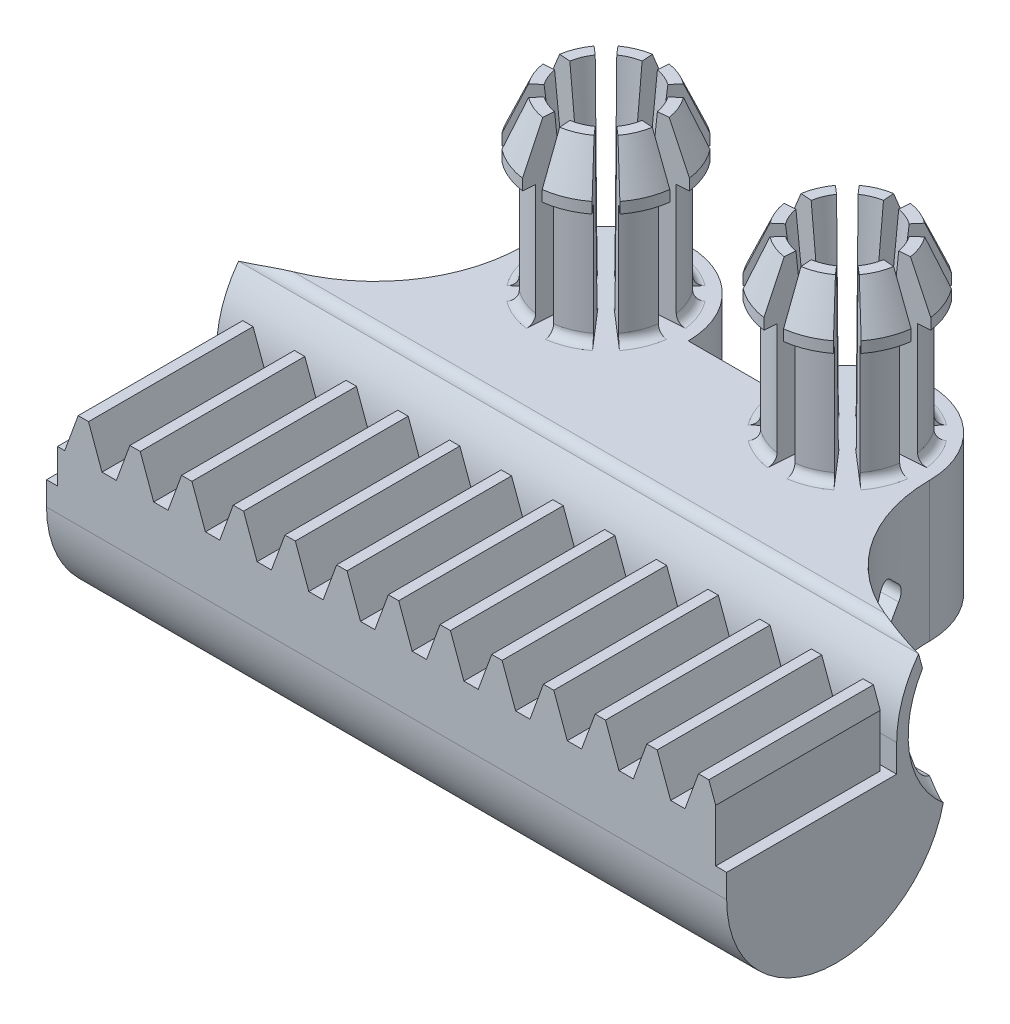
from build123d import *

# Parameters (mm, degrees)
BLANKSKE_W                 = 60
BLANKSKE_H                 = 6.5
BLANK_DEPTH                = 10
TOOTHCUTSIM_DEPTH          = 62.173932357
TEETHCUTS_COUNT            = 14
TEETHCUTS_PITCH            = 4.712388975
BOSS_EXTRUDE1_DEPTH        = 1
BOSS_EXTRUDE1_DEPTH_BACK   = 61
BOSS_EXTRUDE2_DEPTH        = 2.71
BOSS_EXTRUDE2_DEPTH_BACK   = 10
SKETCH2_R                  = 7.5
BOSS_EXTRUDE2_2_DEPTH      = 2.71
BOSS_EXTRUDE2_2_DEPTH_BACK = 10
BOSS_EXTRUDE3_REACH        = 74.801
CUT_EXTRUDE1_REACH         = 74.801
CIRPATTERN1_COUNT          = 8
FILLET1_R                  = 0.8
MIRROR2_COPY_1_REACH       = 74.801
MIRROR2_COPY_2_REACH       = 74.801
MIRROR2_COPY_3_REACH       = 74.801
MIRROR2_COPY_4_REACH       = 74.801
MIRROR2_COPY_5_REACH       = 74.801
MIRROR2_COPY_6_REACH       = 74.801
MIRROR2_COPY_7_REACH       = 74.801
FILLET1_OF_MIRROR2_R       = 0.8
CUT_EXTRUDE2_REACH         = 76.845
FILLET2_R                  = 8
BOSS_EXTRUDE4_DEPTH        = 5
CUT_EXTRUDE3_REACH         = 76.845
FILLET3_R                  = 10
FILLET4_R                  = 1


with BuildPart() as part:
    # BlankSke → Blank (new body)
    with BuildSketch(Plane.XY):
        with Locations((30, 3.25)):
            Rectangle(BLANKSKE_W, BLANKSKE_H)
    extrude(amount=-BLANK_DEPTH)

    # TooCutSkeSim → ToothCutSim (cut, through all)
    with BuildSketch(Plane.XY):
        Polygon((0.654653055, 3.125), (-0.654653055, 3.125), (-1.892297439, 6.5254), (1.892297439, 6.5254), align=None)
    toothcutsim = extrude(amount=-TOOTHCUTSIM_DEPTH, mode=Mode.SUBTRACT)

    # TeethCuts: ToothCutSim ×14
    with Locations(*[(i * TEETHCUTS_PITCH, 0, 0) for i in range(1, TEETHCUTS_COUNT)]):
        add(toothcutsim, mode=Mode.SUBTRACT)

    # Sketch1 → Boss-Extrude1 (add, two sides: drawn at the far end of the back side and taken through both)
    with BuildSketch(Plane(origin=(60, 0, 0), x_dir=(0, 0, -1), z_dir=(1, 0, 0)).offset(-BOSS_EXTRUDE1_DEPTH_BACK)):
        with BuildLine():
            Line((0, 0), (0, -10.820508076))
            ThreePointArc((0, -10.820508076), (11.085943312, -10.095069348), (14.660347579, 0.423867603))
            Line((14.660347579, 0.423867603), (12.5, 8.5))
            Line((12.5, 8.5), (10.5, 8.5))
            Line((10.5, 8.5), (10.5, 0))
            Line((10.5, 0), (0, 0))
        make_face()
    extrude(amount=BOSS_EXTRUDE1_DEPTH + BOSS_EXTRUDE1_DEPTH_BACK)


with BuildPart() as body_2:
    # Sketch2 → Boss-Extrude2 (new, two sides: drawn at the far end of the back side and taken through both)
    with BuildSketch(Plane(origin=(0, 6.5, 0), x_dir=(1, 0, 0), z_dir=(0, 1, 0)).offset(-BOSS_EXTRUDE2_DEPTH_BACK)):
        with Locations(Location((19, 26, 0), (0, 0, 270))):
            Circle(SKETCH2_R)
    extrude(amount=BOSS_EXTRUDE2_DEPTH + BOSS_EXTRUDE2_DEPTH_BACK)


with BuildPart() as body_3:
    # Sketch2 → Boss-Extrude2 2 (new, two sides: drawn at the far end of the back side and taken through both)
    with BuildSketch(Plane(origin=(0, 6.5, 0), x_dir=(1, 0, 0), z_dir=(0, 1, 0)).offset(-BOSS_EXTRUDE2_2_DEPTH_BACK)):
        with Locations(Location((41, 26, 0), (0, 0, 90))):
            Circle(SKETCH2_R)
    extrude(amount=BOSS_EXTRUDE2_2_DEPTH + BOSS_EXTRUDE2_2_DEPTH_BACK)

    # Boss-Extrude3: up to this face of the body (flat: up to its plane)
    boss_extrude3_end = Plane(body_3.part.faces().sort_by_distance((41, -3.5, -26))[0])
    # Sketch3 → Boss-Extrude3 (add, up to the picked face)
    with BuildSketch(Plane(origin=(0, 9.21, 0), x_dir=(1, 0, 0), z_dir=(0, 1, 0)), mode=Mode.PRIVATE) as boss_extrude3_sk1:
        with BuildLine():
            Line((33.5, 26), (26.5, 26))
            ThreePointArc((26.5, 26), (19, 18.5), (11.5, 26))
            ThreePointArc((11.5, 26), (7.895119526, 16.800815254), (-1, 12.5))
            Line((-1, 12.5), (61, 12.5))
            ThreePointArc((61, 12.5), (52.104880474, 16.800815254), (48.5, 26))
            ThreePointArc((48.5, 26), (41, 18.5), (33.5, 26))
        make_face()
    boss_extrude3_tool1 = split(extrude(boss_extrude3_sk1.sketch, amount=-BOSS_EXTRUDE3_REACH, mode=Mode.PRIVATE), bisect_by=boss_extrude3_end, keep=Keep.BOTH, mode=Mode.PRIVATE)

    add(part.part)  # Boss-Extrude3 merges part

    add(body_2.part)  # Boss-Extrude3 merges body 2
    add(boss_extrude3_tool1.solids().sort_by(Axis((30, 9.21, -16.953382), (0, -1, 0)))[0])

    # Sketch4 → Revolve1 (revolve)
    with BuildSketch(Plane.ZY.offset(-19)):
        Polygon((-31.65, 9.21), (-31.65, 20.21), (-32.77, 20.21), (-32.77, 21.21), (-31.05, 25.21), (-30.05, 25.21), (-28.45, 9.21), align=None)
    revolve1 = revolve(axis=Axis((19, 9.21, -26), (0, 1, 0)))

    # Sketch5 → Cut-Extrude1 (cut, up to next)
    with BuildSketch(Plane(origin=(0, 9.21, 0), x_dir=(1, 0, 0), z_dir=(0, 1, 0)), mode=Mode.PRIVATE) as cut_extrude1_sk1:
        Polygon((19, 26.4), (25.77, 26.9), (25.77, 25.1), (19, 25.6), align=None)
    cut_extrude1_tool1 = extrude(cut_extrude1_sk1.sketch, amount=CUT_EXTRUDE1_REACH, mode=Mode.PRIVATE) & body_3.part
    cut_extrude1 = cut_extrude1_tool1.solids().sort_by_distance((22.818974, 9.21, -26))[0]
    add(cut_extrude1, mode=Mode.SUBTRACT)

    # CirPattern1: Cut-Extrude1 ×8 about axis
    cirpattern1_axis = Axis((19, 0, -26), (0, 1, 0))
    for i in range(1, CIRPATTERN1_COUNT):
        add(cut_extrude1.rotate(cirpattern1_axis, i * 360 / CIRPATTERN1_COUNT), mode=Mode.SUBTRACT)

    # Fillet1
    fillet1_edges = [body_3.edges().sort_by_distance(p)[0] for p in [
        (18.062425591, 9.21, -28.263504855),
        (16.736495145, 9.21, -26.937574409),
        (16.736495145, 9.21, -25.062425591),
        (18.062425591, 9.21, -23.736495145),
        (19.937574409, 9.21, -23.736495145),
        (21.263504855, 9.21, -25.062425591),
        (21.263504855, 9.21, -26.937574409),
        (19.937574409, 9.21, -28.263504855),
        (13.780080641, 9.21, -28.162161393),
        (16.837838607, 9.21, -31.219919359),
        (21.162161393, 9.21, -31.219919359),
        (24.219919359, 9.21, -28.162161393),
        (24.219919359, 9.21, -23.837838607),
        (21.162161393, 9.21, -20.780080641),
        (13.780080641, 9.21, -23.837838607),
        (16.837838607, 9.21, -20.780080641),
    ]]
    fillet(fillet1_edges, radius=FILLET1_R)

    # Mirror2: Revolve1, Cut-Extrude1 across plane
    add(revolve1.mirror(Plane.ZY.offset(-30)))
    add(cut_extrude1.mirror(Plane.ZY.offset(-30)), mode=Mode.SUBTRACT)

    # Mirror2 copy 1 sketch → Mirror2 copy 1 (cut, up to next)
    with BuildSketch(Plane(origin=(36.050252532, 9.21, 5.819805153), x_dir=(-0.7071067811865476, 0, -0.7071067811865475), z_dir=(0, 1, 0)), mode=Mode.PRIVATE) as mirror2_copy_1_sk1:
        Polygon((19, -26.4), (25.77, -26.9), (25.77, -25.1), (19, -25.6), align=None)
    mirror2_copy_1_tool1 = extrude(mirror2_copy_1_sk1.sketch, amount=MIRROR2_COPY_1_REACH, mode=Mode.PRIVATE) & body_3.part
    add(mirror2_copy_1_tool1.solids().sort_by_distance((38.299577587, 9.21, -28.700422413))[0], mode=Mode.SUBTRACT)

    # Mirror2 copy 2 sketch → Mirror2 copy 2 (cut, up to next)
    with BuildSketch(Plane(origin=(15, 9.21, -7), x_dir=(0, 0, -1), z_dir=(0, 1, 0)), mode=Mode.PRIVATE) as mirror2_copy_2_sk1:
        Polygon((19, -26.4), (25.77, -26.9), (25.77, -25.1), (19, -25.6), align=None)
    mirror2_copy_2_tool1 = extrude(mirror2_copy_2_sk1.sketch, amount=MIRROR2_COPY_2_REACH, mode=Mode.PRIVATE) & body_3.part
    add(mirror2_copy_2_tool1.solids().sort_by_distance((41, 9.21, -29.818974))[0], mode=Mode.SUBTRACT)

    # Mirror2 copy 3 sketch → Mirror2 copy 3 (cut, up to next)
    with BuildSketch(Plane(origin=(9.180194847, 9.21, -30.949747468), x_dir=(0.7071067811865475, 0, -0.7071067811865476), z_dir=(0, 1, 0)), mode=Mode.PRIVATE) as mirror2_copy_3_sk1:
        Polygon((19, -26.4), (25.77, -26.9), (25.77, -25.1), (19, -25.6), align=None)
    mirror2_copy_3_tool1 = extrude(mirror2_copy_3_sk1.sketch, amount=MIRROR2_COPY_3_REACH, mode=Mode.PRIVATE) & body_3.part
    add(mirror2_copy_3_tool1.solids().sort_by_distance((43.700422413, 9.21, -28.700422413))[0], mode=Mode.SUBTRACT)

    # Mirror2 copy 4 sketch → Mirror2 copy 4 (cut, up to next)
    with BuildSketch(Plane(origin=(22, 9.21, -52), x_dir=(1, 0, 0), z_dir=(0, 1, 0)), mode=Mode.PRIVATE) as mirror2_copy_4_sk1:
        Polygon((19, -26.4), (25.77, -26.9), (25.77, -25.1), (19, -25.6), align=None)
    mirror2_copy_4_tool1 = extrude(mirror2_copy_4_sk1.sketch, amount=MIRROR2_COPY_4_REACH, mode=Mode.PRIVATE) & body_3.part
    add(mirror2_copy_4_tool1.solids().sort_by_distance((44.818974, 9.21, -26))[0], mode=Mode.SUBTRACT)

    # Mirror2 copy 5 sketch → Mirror2 copy 5 (cut, up to next)
    with BuildSketch(Plane(origin=(45.949747468, 9.21, -57.819805153), x_dir=(0.7071067811865477, 0, 0.7071067811865475), z_dir=(0, 1, 0)), mode=Mode.PRIVATE) as mirror2_copy_5_sk1:
        Polygon((19, -26.4), (25.77, -26.9), (25.77, -25.1), (19, -25.6), align=None)
    mirror2_copy_5_tool1 = extrude(mirror2_copy_5_sk1.sketch, amount=MIRROR2_COPY_5_REACH, mode=Mode.PRIVATE) & body_3.part
    add(mirror2_copy_5_tool1.solids().sort_by_distance((43.700422413, 9.21, -23.299577587))[0], mode=Mode.SUBTRACT)

    # Mirror2 copy 6 sketch → Mirror2 copy 6 (cut, up to next)
    with BuildSketch(Plane(origin=(67, 9.21, -45), x_dir=(0, 0, 1), z_dir=(0, 1, 0)), mode=Mode.PRIVATE) as mirror2_copy_6_sk1:
        Polygon((19, -26.4), (25.77, -26.9), (25.77, -25.1), (19, -25.6), align=None)
    mirror2_copy_6_tool1 = extrude(mirror2_copy_6_sk1.sketch, amount=MIRROR2_COPY_6_REACH, mode=Mode.PRIVATE) & body_3.part
    add(mirror2_copy_6_tool1.solids().sort_by_distance((41, 9.21, -22.181026))[0], mode=Mode.SUBTRACT)

    # Mirror2 copy 7 sketch → Mirror2 copy 7 (cut, up to next)
    with BuildSketch(Plane(origin=(72.819805153, 9.21, -21.050252532), x_dir=(-0.7071067811865474, 0, 0.7071067811865477), z_dir=(0, 1, 0)), mode=Mode.PRIVATE) as mirror2_copy_7_sk1:
        Polygon((19, -26.4), (25.77, -26.9), (25.77, -25.1), (19, -25.6), align=None)
    mirror2_copy_7_tool1 = extrude(mirror2_copy_7_sk1.sketch, amount=MIRROR2_COPY_7_REACH, mode=Mode.PRIVATE) & body_3.part
    add(mirror2_copy_7_tool1.solids().sort_by_distance((38.299577587, 9.21, -23.299577587))[0], mode=Mode.SUBTRACT)

    # Fillet1 of Mirror2
    fillet1_of_mirror2_edges = [body_3.edges().sort_by_distance(p)[0] for p in [
        (41.937574409, 9.21, -28.263504855),
        (43.263504855, 9.21, -26.937574409),
        (43.263504855, 9.21, -25.062425591),
        (41.937574409, 9.21, -23.736495145),
        (40.062425591, 9.21, -23.736495145),
        (38.736495145, 9.21, -25.062425591),
        (38.736495145, 9.21, -26.937574409),
        (40.062425591, 9.21, -28.263504855),
        (46.219919359, 9.21, -28.162161393),
        (43.162161393, 9.21, -31.219919359),
        (38.837838607, 9.21, -31.219919359),
        (35.780080641, 9.21, -28.162161393),
        (35.780080641, 9.21, -23.837838607),
        (38.837838607, 9.21, -20.780080641),
        (46.219919359, 9.21, -23.837838607),
        (43.162161393, 9.21, -20.780080641),
    ]]
    fillet(fillet1_of_mirror2_edges, radius=FILLET1_OF_MIRROR2_R)

    # Sketch6 → Cut-Extrude2 (cut, up to next)
    with BuildSketch(Plane.ZY.offset(1), mode=Mode.PRIVATE) as cut_extrude2_sk1:
        with BuildLine():
            Line((-24, -3.5), (-21.666547622, -1.166547622))
            ThreePointArc((-21.666547622, -1.166547622), (-21.373654403, -0.459440841), (-21.666547622, 0.24766594))
            Line((-21.666547622, 0.24766594), (-22.797918472, 1.37903679))
            ThreePointArc((-22.797918472, 1.37903679), (-23.090811691, 2.086143571), (-22.797918472, 2.793250353))
            Line((-22.797918472, 2.793250353), (-21.666547622, 3.924621202))
            ThreePointArc((-21.666547622, 3.924621202), (-20.959440841, 4.217514421), (-20.25233406, 3.924621202))
            Line((-20.25233406, 3.924621202), (-18.070353544, 1.742640687))
            ThreePointArc((-18.070353544, 1.742640687), (-17.745930196, 1.525867936), (-17.363246763, 1.449747468))
            Line((-17.363246763, 1.449747468), (-15.077460326, 1.449747468))
            ThreePointArc((-15.077460326, 1.449747468), (-14.370353544, 1.156854249), (-14.077460326, 0.449747468))
            Line((-14.077460326, 0.449747468), (-14.077460326, -2.075735931))
            ThreePointArc((-14.077460326, -2.075735931), (-14.370353544, -2.782842712), (-15.077460326, -3.075735931))
            Line((-15.077460326, -3.075735931), (-17.363246763, -3.075735931))
            ThreePointArc((-17.363246763, -3.075735931), (-17.745930196, -3.151856399), (-18.070353544, -3.36862915))
            Line((-18.070353544, -3.36862915), (-18.201724394, -3.5))
            Line((-18.201724394, -3.5), (-24, -3.5))
        make_face()
    cut_extrude2_tool1 = extrude(cut_extrude2_sk1.sketch, amount=-CUT_EXTRUDE2_REACH, mode=Mode.PRIVATE) & body_3.part
    add(cut_extrude2_tool1.solids().sort_by_distance((-1, -0.331084, -18.834749))[0], mode=Mode.SUBTRACT)

    # Fillet2
    # the kernel refuses this fillet: 8 mm, written as the material it adds along each edge
    with BuildSketch(Plane(origin=(63.894117357, -3.5, -14.909847666), x_dir=(0, -0.9466798920517902, 0.32217570048780975), z_dir=(-1, 0, 0))) as fillet2_piece_1_section:
        with BuildLine():
            CenterArc((5.388324342, -7.85046969), FILLET2_R, 101.095223226, 42.622452436)
            Line((-1.060562691, -3.116353506), (-1.189540432, -3.021671182))
            ThreePointArc((-1.189540432, -3.021671182), (-0.681750128, -1.506628641), (-0.151468783, 0.051548112))
            Line((-0.151468783, 0.051548112), (0.030790425, 0.157009394))
            ThreePointArc((0.030790425, 0.157009394), (1.924401551, -0.026912888), (3.818012676, 0.157009394))
            Line((3.818012676, 0.157009394), (3.848803101, 0))
        make_face()
    fillet2_piece_1 = extrude(amount=67.788234714, mode=Mode.PRIVATE)
    fillet2_piece_1 = fillet2_piece_1 - Plane(origin=(-2.04, -4.410033304, -26), x_dir=(1, 0, 0), z_dir=(0, 1, 0)) * Cylinder(13.54, 151, mode=Mode.PRIVATE)
    fillet2_piece_1 = fillet2_piece_1 - Plane(origin=(62.04, -4.410033304, -26), x_dir=(-0.07680945347119736, 0, 0.9970457902511077), z_dir=(0, 1, 0)) * Cylinder(13.54, 151, mode=Mode.PRIVATE)
    fillet2_piece_1 = split(fillet2_piece_1, bisect_by=Plane(origin=(30.00001549, -2.608834868, -17.310559262), z_dir=(0, -0.7071067811865488, 0.7071067811865464)), keep=Keep.TOP, mode=Mode.PRIVATE)
    add(fillet2_piece_1)

    # Sketch7 → Boss-Extrude4 (add)
    with BuildSketch(Plane.XY):
        Polygon((60, 0), (60, 4.791080254), (59.37800408, 6.5), (58.431720295, 6.5), (57.203320754, 3.125), (55.894014645, 3.125), (54.665615105, 6.5), (53.71933132, 6.5), (52.490931779, 3.125), (51.18162567, 3.125), (49.95322613, 6.5), (49.006942345, 6.5), (47.778542804, 3.125), (46.469236695, 3.125), (45.240837155, 6.5), (44.29455337, 6.5), (43.066153829, 3.125), (41.75684772, 3.125), (40.52844818, 6.5), (39.582164395, 6.5), (38.353764854, 3.125), (37.044458745, 3.125), (35.816059205, 6.5), (34.86977542, 6.5), (33.641375879, 3.125), (32.33206977, 3.125), (31.10367023, 6.5), (30.157386445, 6.5), (28.928986904, 3.125), (27.619680795, 3.125), (26.391281255, 6.5), (25.44499747, 6.5), (24.216597929, 3.125), (22.90729182, 3.125), (21.67889228, 6.5), (20.732608495, 6.5), (19.504208954, 3.125), (18.194902845, 3.125), (16.966503305, 6.5), (16.02021952, 6.5), (14.791819979, 3.125), (13.48251387, 3.125), (12.25411433, 6.5), (11.307830545, 6.5), (10.079431004, 3.125), (8.770124895, 3.125), (7.541725355, 6.5), (6.59544157, 6.5), (5.367042029, 3.125), (4.05773592, 3.125), (2.82933638, 6.5), (1.883052595, 6.5), (0.654653055, 3.125), (0, 3.125), (0, 0), (-1, 0), (-1, -10.820508076), (61, -10.820508076), (61, 0), align=None)
    extrude(amount=BOSS_EXTRUDE4_DEPTH)

    # Sketch8 → Cut-Extrude3 (cut, up to next)
    with BuildSketch(Plane.ZY.offset(1), mode=Mode.PRIVATE) as cut_extrude3_sk1:
        with BuildLine():
            Line((5, -2.160254038), (5, -12.160254038))
            Line((5, -12.160254038), (-5, -12.160254038))
            ThreePointArc((-5, -12.160254038), (2.071067812, -9.23132185), (5, -2.160254038))
        make_face()
    cut_extrude3_tool1 = extrude(cut_extrude3_sk1.sketch, amount=-CUT_EXTRUDE3_REACH, mode=Mode.PRIVATE) & body_3.part
    add(cut_extrude3_tool1.solids().sort_by_distance((-1, -9.926575, 2.766321))[0], mode=Mode.SUBTRACT)

    # Fillet3
    # the kernel refuses this fillet: 10 mm, written as the material it takes off along each edge
    with BuildSketch(Plane(origin=(76, 8.5, -10.5), x_dir=(0, 0, -1), z_dir=(-1, 0, 0))) as fillet3_piece_1:
        with BuildLine():
            CenterArc((10, 6), FILLET3_R, 180, 36.869897646)
            Line((0, 6), (-0.2, 6))
            Line((-0.2, 6), (-0.2, 0))
            Line((-0.2, 0), (0, -0.2))
            ThreePointArc((0, -0.2), (1, -0.2), (1.84, -0.12))
            Line((1.84, -0.12), (2, 0))
        make_face()
    extrude(amount=92, mode=Mode.SUBTRACT)

    # Fillet4
    # the kernel refuses this fillet: 1 mm, written as the material it takes off along each edge
    with BuildSketch(Plane(origin=(-3.392566613, 9.21, -12.5), x_dir=(0, -1.0, -7.1279445569583e-12), z_dir=(1, 0, 0))) as fillet4_piece_1:
        with BuildLine():
            CenterArc((1, 0.957026645), FILLET4_R, 180, 73.142043978)
            Line((0, 0.957026645), (-0.02, 0.957026645))
            Line((-0.02, 0.957026645), (-0.02, 0))
            Line((-0.02, 0), (0, -0.02))
            ThreePointArc((0, -0.02), (0.355, -0.02), (0.7042, -0.019140533))
            Line((0.7042, -0.019140533), (0.71, 0))
        make_face()
    extrude(amount=66.785133227, mode=Mode.SUBTRACT)

    # Sketch10 → Cut-Revolve1 (revolve, cut)
    with BuildSketch(Plane.ZY.offset(1)):
        with BuildLine():
            Line((-14.95865505, 9.538158358), (-14.95865505, -4.538158358))
            ThreePointArc((-14.95865505, -4.538158358), (-11.542200218, 2.5), (-14.95865505, 9.538158358))
        make_face()
    cut_revolve1 = revolve(axis=Axis((-1, 10.062846731, -14.95865505), (0, -1, 0)), mode=Mode.SUBTRACT)

    # Mirror3: Cut-Revolve1 across plane
    add(cut_revolve1.mirror(Plane.ZY.offset(-30)), mode=Mode.SUBTRACT)


solid = body_3.part
